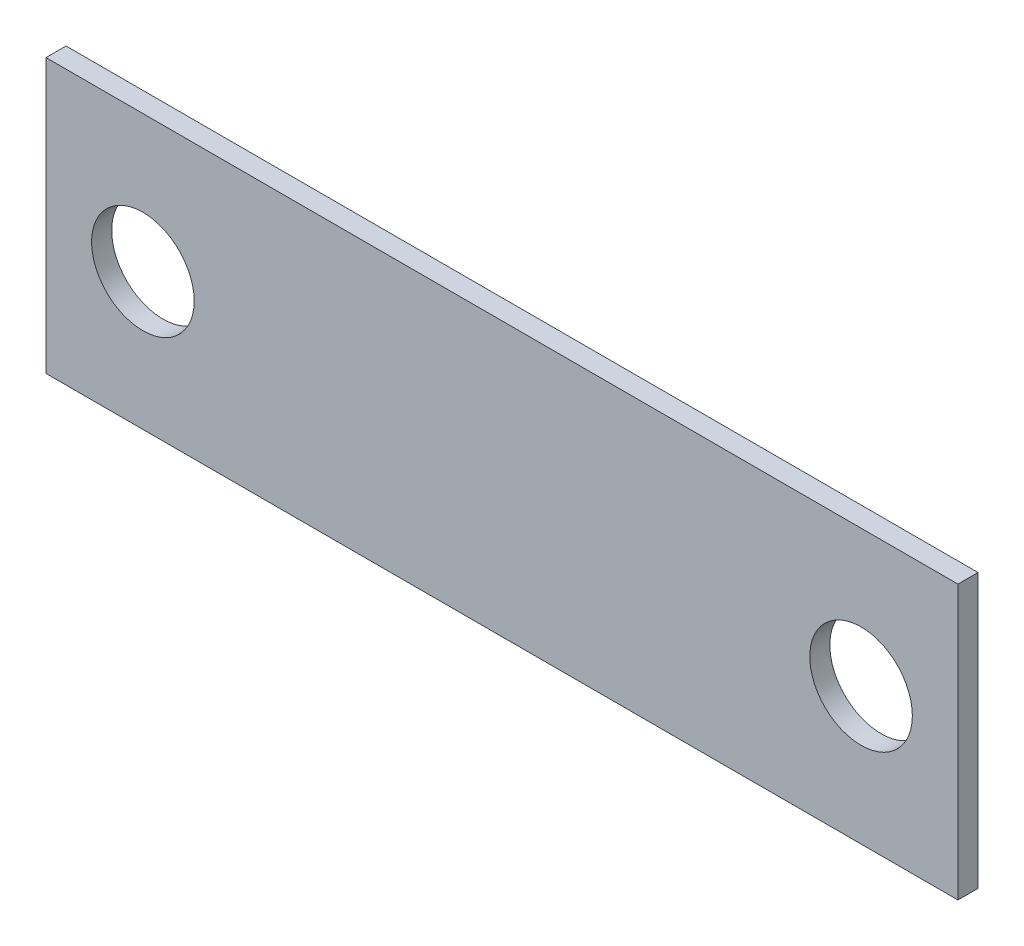
from build123d import *

# Parameters (mm, degrees)
SKETCH1_W           = 254
SKETCH1_H           = 76.2
BOSS_EXTRUDE1_DEPTH = 5.588
SKETCH2_R           = 14.2875
CUT_EXTRUDE1_DEPTH  = 133.709591756


with BuildPart() as part:
    # Sketch1 → Boss-Extrude1 (new body)
    with BuildSketch(Plane.XY):
        Rectangle(SKETCH1_W, SKETCH1_H)
    extrude(amount=BOSS_EXTRUDE1_DEPTH)

    # Sketch2 → Cut-Extrude1 (cut, through all)
    with BuildSketch(Plane.XY.offset(5.588)):
        with Locations((-100.0125, 0)):
            Circle(SKETCH2_R)
        with Locations((100.0125, 0)):
            Circle(SKETCH2_R)
    extrude(amount=-CUT_EXTRUDE1_DEPTH, mode=Mode.SUBTRACT)


solid = part.part
